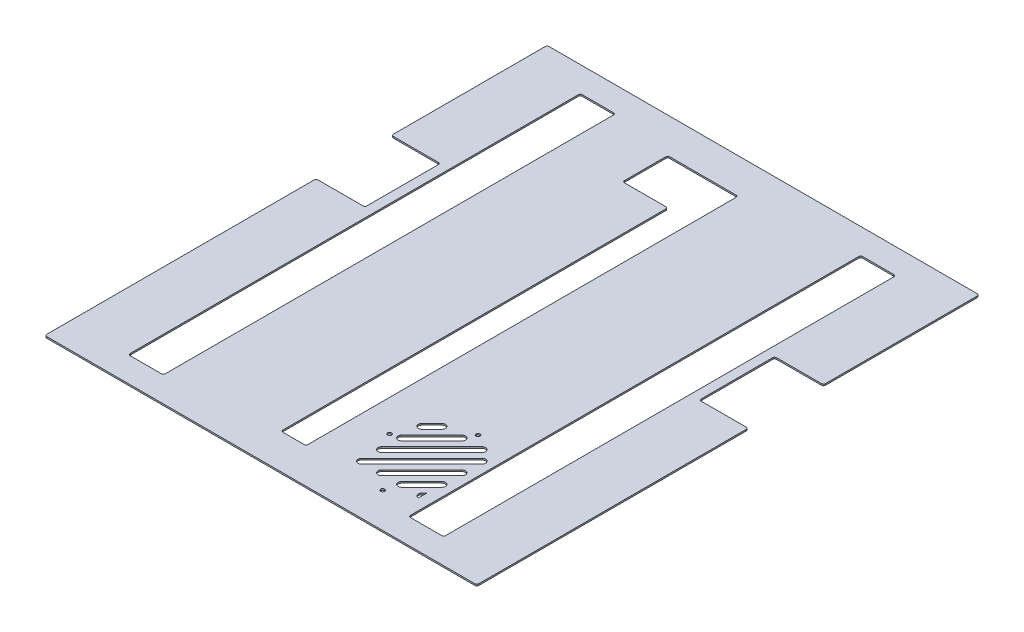
from build123d import *

# Parameters (mm, degrees)
SKETCH1_W           = 430
SKETCH1_H           = 500
BOSS_EXTRUDE1_DEPTH = 1.5
SKETCH2_W           = 48.6
SKETCH2_H           = 75
CUT_EXTRUDE1_DEPTH  = 10
SKETCH3_W           = 35
SKETCH3_H           = 450
CUT_EXTRUDE2_DEPTH  = 10
CUT_EXTRUDE3_DEPTH  = 10
FILLET2_R           = 2
FILLET3_R           = 2
SKETCH6_R           = 2
CUT_EXTRUDE4_DEPTH  = 10


with BuildPart() as part:
    # Sketch1 → Boss-Extrude1 (new body)
    with BuildSketch(Plane(origin=(0, 0, 0), x_dir=(1, 0, 0), z_dir=(0, 1, 0))):
        with Locations((6126.084066999, -8702.312377786)):
            Rectangle(SKETCH1_W, SKETCH1_H)
    extrude(amount=BOSS_EXTRUDE1_DEPTH)

    # Sketch2 → Cut-Extrude1 (cut)
    with BuildSketch(Plane(origin=(0, 1.5, 0), x_dir=(1, 0, 0), z_dir=(0, 1, 0))):
        with Locations((5935.384066999, -8644.812377786)):
            Rectangle(SKETCH2_W, SKETCH2_H)
        with Locations((6316.784066999, -8644.812377786)):
            Rectangle(SKETCH2_W, SKETCH2_H)
    extrude(amount=-CUT_EXTRUDE1_DEPTH, mode=Mode.SUBTRACT)

    # Sketch3 → Cut-Extrude2 (cut)
    with BuildSketch(Plane(origin=(0, 1.5, 0), x_dir=(1, 0, 0), z_dir=(0, 1, 0))):
        Polygon((5969.084066999, -8541.651929061), (5969.084066999, -8927.312377786), (6004.084066999, -8927.312377786), (6004.084066999, -8477.312377786), (5969.084066999, -8477.312377786), align=None)
        with Locations((6265.584066999, -8702.312377786)):
            Rectangle(SKETCH3_W, SKETCH3_H)
        Polygon((6102.084066999, -8487.312377786), (6136.084066999, -8487.312377786), (6136.084066999, -8917.312377786), (6111.084066999, -8917.312377786), (6111.084066999, -8532.312377786), (6066.084066999, -8532.312377786), (6066.084066999, -8487.312377786), align=None)
    extrude(amount=-CUT_EXTRUDE2_DEPTH, mode=Mode.SUBTRACT)

    # Sketch4 → Cut-Extrude3 (cut)
    with BuildSketch(Plane(origin=(0, 1.5, 0), x_dir=(1, 0, 0), z_dir=(0, 1, 0))):
        with BuildLine():
            Line((6234.584067167, -8840.596520357), (6177.084066999, -8898.096518708))
            Line((6177.084066999, -8898.096518708), (6174.584066999, -8900.596520952))
            ThreePointArc((6174.584066999, -8900.596520952), (6174.584069168, -8905.596518633), (6179.584066849, -8905.596518637))
            Line((6179.584066849, -8905.596518637), (6237.084067092, -8848.096520211))
            Line((6237.084067092, -8848.096520211), (6239.584067017, -8845.596520365))
            ThreePointArc((6239.584067017, -8845.596520365), (6239.584067096, -8840.596520436), (6234.584067167, -8840.596520357))
        make_face()
        with BuildLine():
            ThreePointArc((6174.584067387, -8880.596519017), (6174.584067598, -8885.596518612), (6179.584067193, -8885.596518981))
            Line((6179.584067193, -8885.596518981), (6229.584067988, -8835.596519766))
            ThreePointArc((6229.584067988, -8835.596519766), (6229.584069287, -8830.596518949), (6224.584068469, -8830.596519802))
            Line((6224.584068469, -8830.596519802), (6222.084069197, -8833.096518708))
            Line((6222.084069197, -8833.096518708), (6174.584067387, -8880.596519017))
        make_face()
        with BuildLine():
            ThreePointArc((6174.584067774, -8860.596519406), (6174.584068372, -8865.596518614), (6179.58406758, -8865.59651937))
            Line((6179.58406758, -8865.59651937), (6209.58406806, -8835.596519838))
            ThreePointArc((6209.58406806, -8835.596519838), (6209.584069287, -8830.596518805), (6204.584068254, -8830.596519874))
            Line((6204.584068254, -8830.596519874), (6174.584067774, -8860.596519406))
        make_face()
        with BuildLine():
            Line((6219.584066911, -8905.596518637), (6239.584067017, -8885.596519163))
            ThreePointArc((6239.584067017, -8885.596519163), (6239.584067096, -8880.596519234), (6234.584067167, -8880.596519155))
            Line((6234.584067167, -8880.596519155), (6214.584067061, -8900.596518629))
            ThreePointArc((6214.584067061, -8900.596518629), (6214.584066907, -8905.596518633), (6219.584066911, -8905.596518637))
        make_face()
        with BuildLine():
            ThreePointArc((6174.584068161, -8840.596519795), (6174.584069146, -8845.596518615), (6179.584067967, -8845.596519759))
            Line((6179.584067967, -8845.596519759), (6189.584068132, -8835.59651991))
            ThreePointArc((6189.584068132, -8835.59651991), (6189.584069431, -8830.596518805), (6184.584068325, -8830.596519946))
            Line((6184.584068325, -8830.596519946), (6174.584068161, -8840.596519795))
        make_face()
        with BuildLine():
            Line((6234.584067693, -8860.59651923), (6194.58406703, -8900.596518629))
            ThreePointArc((6194.58406703, -8900.596518629), (6194.584066876, -8905.596518633), (6199.58406688, -8905.596518637))
            Line((6199.58406688, -8905.596518637), (6237.084067092, -8868.096519609))
            Line((6237.084067092, -8868.096519609), (6239.584067543, -8865.596517133))
            ThreePointArc((6239.584067543, -8865.596517133), (6239.584066044, -8860.596518783), (6234.584067693, -8860.59651923))
        make_face()
        with BuildLine():
            Line((6237.084067092, -8898.096518708), (6234.584067092, -8900.596518629))
            ThreePointArc((6234.584067092, -8900.596518629), (6233.817659407, -8904.449508447), (6237.084067092, -8906.632051027))
            Line((6237.084067092, -8906.632051027), (6237.084067092, -8898.096518708))
        make_face()
    extrude(amount=-CUT_EXTRUDE3_DEPTH, mode=Mode.SUBTRACT)

    # Fillet2
    fillet2_edges = [part.edges().sort_by_distance(p)[0] for p in [
        (6292.484066999, 0.75, 8607.312377786),
        (6341.084066999, 0.75, 8607.312377786),
        (6341.084066999, 0.75, 8682.312377786),
        (6292.484066999, 0.75, 8682.312377786),
        (5959.684066999, 0.75, 8607.312377786),
        (5959.684066999, 0.75, 8682.312377786),
        (5911.084066999, 0.75, 8682.312377786),
        (5911.084066999, 0.75, 8607.312377786),
        (5911.084066999, 0.75, 8452.312377786),
        (6341.084066999, 0.75, 8452.312377786),
        (6341.084066999, 0.75, 8952.312377786),
        (5911.084066999, 0.75, 8952.312377786),
    ]]
    fillet(fillet2_edges, radius=FILLET2_R)

    # Fillet3
    fillet3_edges = [part.edges().sort_by_distance(p)[0] for p in [
        (6004.084066999, 0.75, 8927.312377786),
        (5969.084066999, 0.75, 8927.312377786),
        (6004.084066999, 0.75, 8477.312377786),
        (5969.084066999, 0.75, 8477.312377786),
        (6283.084066999, 0.75, 8927.312377786),
        (6248.084066999, 0.75, 8927.312377786),
        (6283.084066999, 0.75, 8477.312377786),
        (6248.084066999, 0.75, 8477.312377786),
        (6136.084066999, 0.75, 8917.312377786),
        (6111.084066999, 0.75, 8917.312377786),
        (6136.084066999, 0.75, 8487.312377786),
        (6111.084066999, 0.75, 8532.312377786),
        (6066.084066999, 0.75, 8487.312377786),
        (6066.084066999, 0.75, 8532.312377786),
    ]]
    fillet(fillet3_edges, radius=FILLET3_R)

    # Sketch6 → Cut-Extrude4 (cut)
    with BuildSketch(Plane(origin=(0, 1.5, 0), x_dir=(1, 0, 0), z_dir=(0, 1, 0))):
        with Locations((6212.584066999, -8822.590833806)):
            Circle(SKETCH6_R)
        with Locations((6212.584066999, -8917.590833806)):
            Circle(SKETCH6_R)
        with Locations((6167.584066999, -8865.596518708)):
            Circle(SKETCH6_R)
    extrude(amount=-CUT_EXTRUDE4_DEPTH, mode=Mode.SUBTRACT)


solid = part.part
